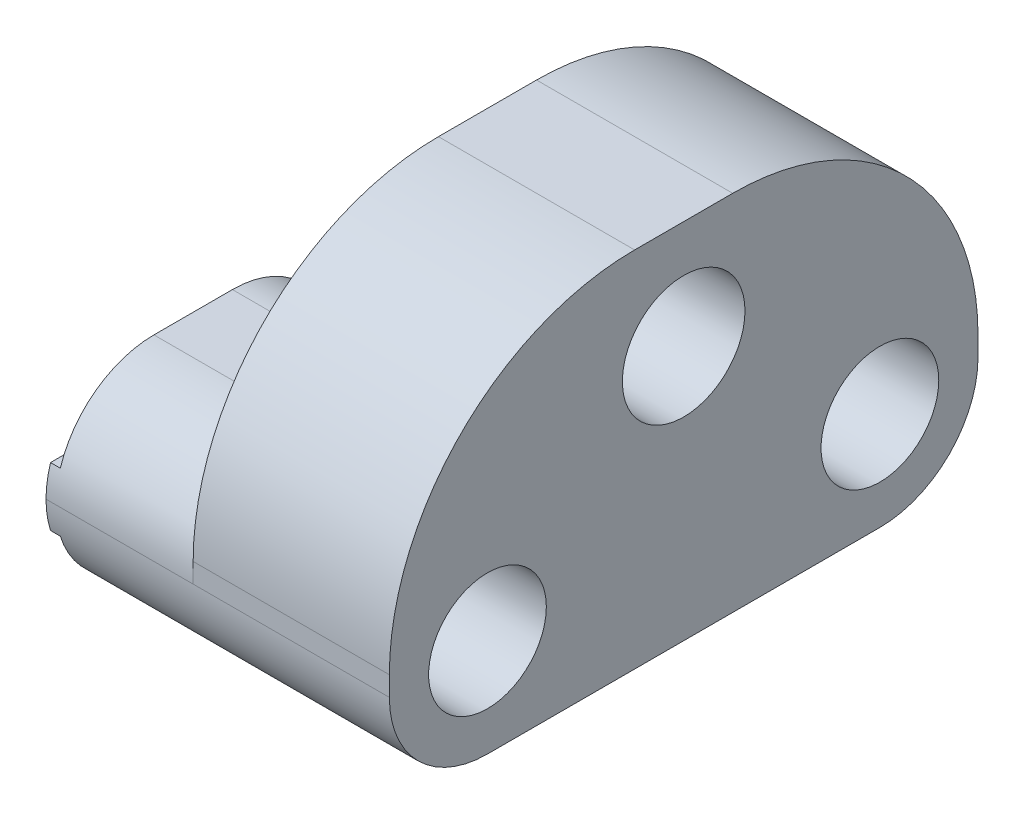
from build123d import *

# Parameters (mm, degrees)
SALIENTE_EXTRUIR1_DEPTH = 60
CROQUIS2_R              = 2.75
CORTAR_EXTRUIR1_DEPTH   = 35
CROQUIS3_R              = 6
CORTAR_EXTRUIR2_DEPTH   = 28
CORTAR_EXTRUIR3_REACH   = 80.702
CROQUIS4_R              = 6.25
CROQUIS5_R              = 10
CORTAR_EXTRUIR4_DEPTH   = 14
REDONDEO1_R             = 10
REDONDEO2_R             = 10
REDONDEO5_R             = 25


with BuildPart() as part:
    # Croquis1 → Saliente-Extruir1 (new body)
    with BuildSketch(Plane.XY):
        Polygon((0, 0), (0, 7), (-1, 7), (-1, 13), (0, 13), (0, 20), (14, 20), (14, 37), (34, 37), (34, 0), align=None)
    extrude(amount=SALIENTE_EXTRUIR1_DEPTH)

    # Croquis2 → Cortar-Extruir1 (cut)
    with BuildSketch(Plane(origin=(34, 0, 0), x_dir=(0, 0, -1), z_dir=(1, 0, 0))):
        with Locations((-50, 10)):
            Circle(CROQUIS2_R)
        with Locations((-10, 10)):
            Circle(CROQUIS2_R)
    extrude(amount=-CORTAR_EXTRUIR1_DEPTH, mode=Mode.SUBTRACT)

    # Croquis3 → Cortar-Extruir2 (cut)
    with BuildSketch(Plane(origin=(34, 0, 0), x_dir=(0, 0, -1), z_dir=(1, 0, 0))):
        with Locations((-50, 10)):
            Circle(CROQUIS3_R)
        with Locations((-10, 10)):
            Circle(CROQUIS3_R)
    extrude(amount=-CORTAR_EXTRUIR2_DEPTH, mode=Mode.SUBTRACT)

    # Croquis4 → Cortar-Extruir3 (cut, up to next)
    with BuildSketch(Plane(origin=(34, 0, 0), x_dir=(0, 0, -1), z_dir=(1, 0, 0)), mode=Mode.PRIVATE) as cortar_extruir3_sk1:
        with Locations((-30, 26)):
            Circle(CROQUIS4_R)
    cortar_extruir3_tool1 = extrude(cortar_extruir3_sk1.sketch, amount=-CORTAR_EXTRUIR3_REACH, mode=Mode.PRIVATE) & part.part
    add(cortar_extruir3_tool1.solids().sort_by_distance((34, 26, 30))[0], mode=Mode.SUBTRACT)

    # Croquis5 → Cortar-Extruir4 (cut)
    with BuildSketch(Plane.ZY.offset(-14)):
        with Locations((30, 26)):
            Circle(CROQUIS5_R)
    extrude(amount=CORTAR_EXTRUIR4_DEPTH, mode=Mode.SUBTRACT)

    # Redondeo1
    redondeo1_edges = [part.edges().sort_by_distance(p)[0] for p in [
        (7, 20, 22),
        (7, 20, 38),
    ]]
    fillet(redondeo1_edges, radius=REDONDEO1_R)

    # Redondeo2
    redondeo2_edges = [part.edges().sort_by_distance(p)[0] for p in [
        (17, 0, 60),
        (7, 20, 60),
        (17, 0, 0),
        (7, 20, 0),
    ]]
    fillet(redondeo2_edges, radius=REDONDEO2_R - 0.0001)  # a hair under: the kernel refuses the full size

    # Redondeo5
    redondeo5_edges = [part.edges().sort_by_distance(p)[0] for p in [
        (24, 37, 60),
        (24, 37, 0),
    ]]
    fillet(redondeo5_edges, radius=REDONDEO5_R)


solid = part.part
